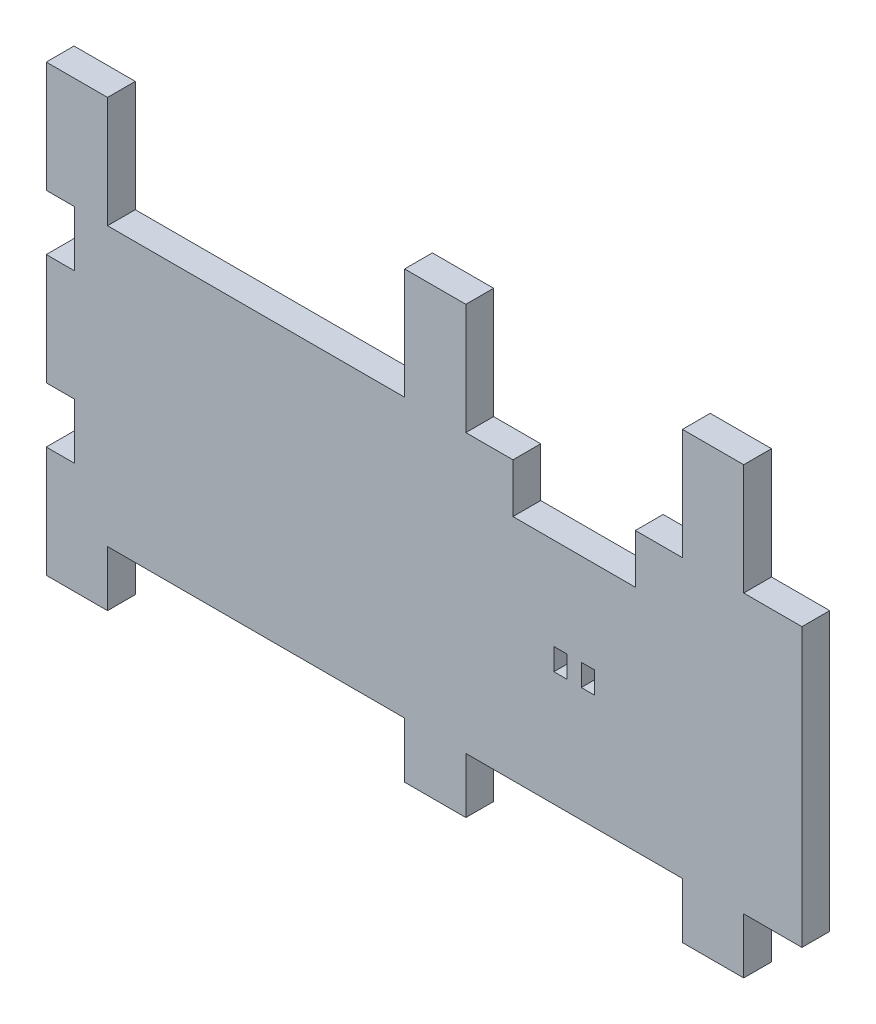
from build123d import *

# Parameters (mm, degrees)
SKETCH2_W           = 177.8
SKETCH2_H           = 101.6
BOSS_EXTRUDE3_DEPTH = 6.35
SKETCH3_W           = 6.459552185
SKETCH3_H           = 12.700236255
SKETCH3_W_2         = 67.9
SKETCH3_H_2         = 25.399763745
SKETCH3_H_3         = 12.7
SKETCH3_W_3         = 49.509
SKETCH3_W_4         = 18.391001019
SKETCH3_W_5         = 18.391
CUT_EXTRUDE3_DEPTH  = 103.587389576
SKETCH4_W           = 27.973
SKETCH4_H           = 11.24
SKETCH4_W_2         = 5.08
SKETCH4_H_2         = 63.500236255
CUT_EXTRUDE4_DEPTH  = 103.587389576
SKETCH5_W           = 3
SKETCH5_H           = 5
CUT_EXTRUDE5_DEPTH  = 10


with BuildPart() as part:
    # Sketch2 → Boss-Extrude3 (new body)
    with BuildSketch(Plane.XY):
        Rectangle(SKETCH2_W, SKETCH2_H)
    extrude(amount=BOSS_EXTRUDE3_DEPTH)

    # Sketch3 → Cut-Extrude3 (cut, through all)
    with BuildSketch(Plane.XY.offset(6.35)):
        with Locations((-85.670223908, 19.050118128)):
            Rectangle(SKETCH3_W, SKETCH3_H)
        with Locations((-40.950001019, 38.100118128)):
            Rectangle(SKETCH3_W_2, SKETCH3_H_2)
        with Locations((-85.670223908, -19.05)):
            Rectangle(SKETCH3_W, SKETCH3_H_3)
        with Locations((31.754498981, 38.100118128)):
            Rectangle(SKETCH3_W_3, SKETCH3_H_2)
        with Locations((79.704499491, 38.100118128)):
            Rectangle(SKETCH3_W_4, SKETCH3_H_2)
        with Locations((-40.95, -44.45)):
            Rectangle(SKETCH3_W_2, SKETCH3_H_3)
        with Locations((79.7045, -44.45)):
            Rectangle(SKETCH3_W_5, SKETCH3_H_3)
        with Locations((31.7545, -44.45)):
            Rectangle(SKETCH3_W_3, SKETCH3_H_3)
    extrude(amount=-CUT_EXTRUDE3_DEPTH, mode=Mode.SUBTRACT)

    # Sketch4 → Cut-Extrude4 (cut, through all)
    with BuildSketch(Plane(origin=(0, 0, 0), x_dir=(-1, 0, 0), z_dir=(0, 0, -1))):
        with Locations((-31.754498981, 19.780236255)):
            Rectangle(SKETCH4_W, SKETCH4_H)
        with Locations((-86.36, -6.349881872)):
            Rectangle(SKETCH4_W_2, SKETCH4_H_2)
    extrude(amount=-CUT_EXTRUDE4_DEPTH, mode=Mode.SUBTRACT)

    # Sketch5 → Cut-Extrude5 (cut)
    with BuildSketch(Plane(origin=(0, 0, 0), x_dir=(-1, 0, 0), z_dir=(0, 0, -1))):
        with Locations((-28.629113636, -9.365763745)):
            Rectangle(SKETCH5_W, SKETCH5_H)
        with Locations((-34.879113636, -9.365763745)):
            Rectangle(SKETCH5_W, SKETCH5_H)
    extrude(amount=-CUT_EXTRUDE5_DEPTH, mode=Mode.SUBTRACT)


solid = part.part
